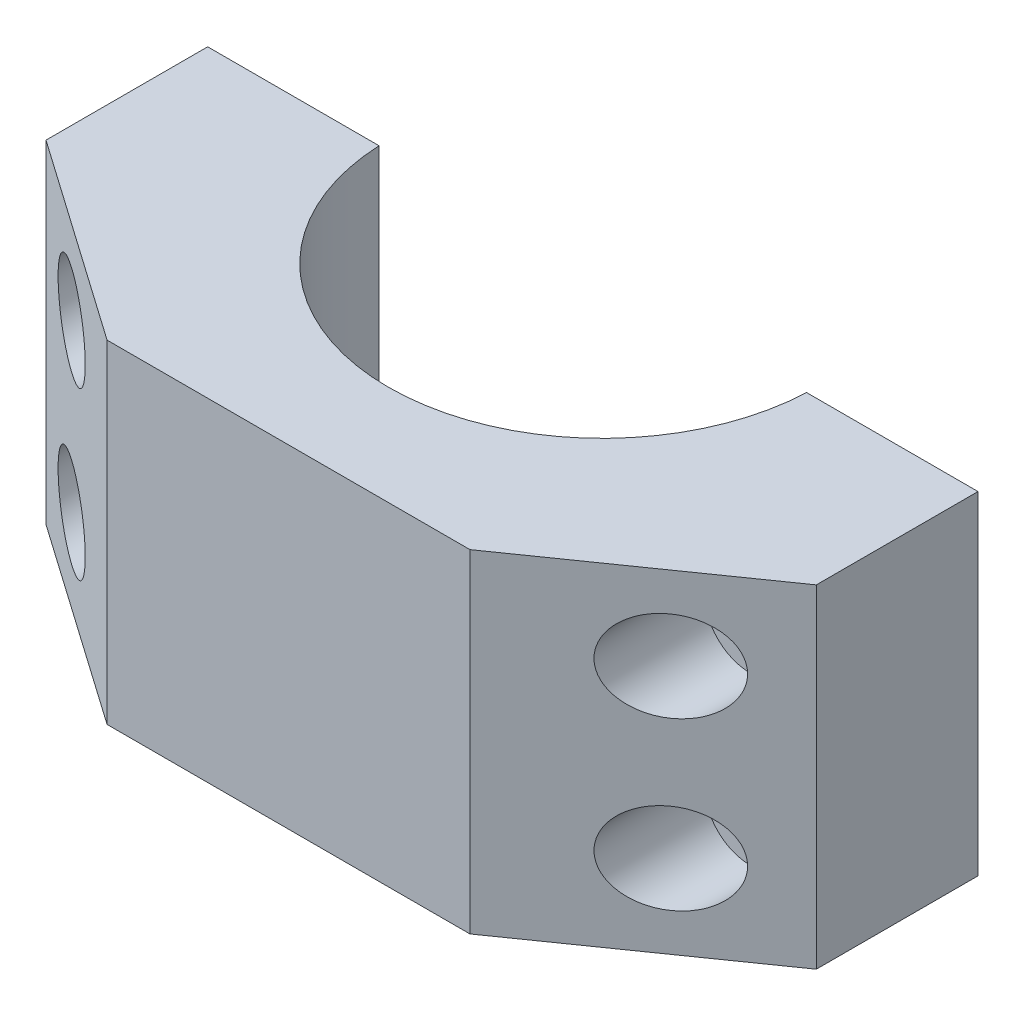
from build123d import *

# Parameters (mm, degrees)
SALIENTE_EXTRUIR1_DEPTH = 35
CORTAR_EXTRUIR1_REACH   = 64.883
CROQUIS2_R              = 2.55
CROQUIS3_R              = 4.75
CORTAR_EXTRUIR2_DEPTH   = 17
CHAFL_N1_SIZE           = 15
CHAFL_N1_SIZE_2         = 21.422220101
CORTAR_EXTRUIR3_START   = -35
CROQUIS4_W              = 81
CROQUIS4_H              = 1
CORTAR_EXTRUIR3_DEPTH   = 35


with BuildPart() as part:
    # Croquis1 → Saliente-Extruir1 (new body)
    with BuildSketch(Plane(origin=(0, 0, 0), x_dir=(1, 0, 0), z_dir=(0, 1, 0))):
        with BuildLine():
            Line((22.5, 0), (40.5, 0))
            Line((40.5, 0), (40.5, -33))
            Line((40.5, -33), (-40.5, -33))
            Line((-40.5, -33), (-40.5, 0))
            Line((-40.5, 0), (-22.5, 0))
            ThreePointArc((-22.5, 0), (0, -22.5), (22.5, 0))
        make_face()
    extrude(amount=SALIENTE_EXTRUIR1_DEPTH)

    # Croquis2 → Cortar-Extruir1 (cut, up to next)
    with BuildSketch(Plane(origin=(0, 0, 0), x_dir=(-1, 0, 0), z_dir=(0, 0, -1)), mode=Mode.PRIVATE) as cortar_extruir1_sk1:
        with Locations((-31.5, 26.25)):
            Circle(CROQUIS2_R)
    cortar_extruir1_tool1 = extrude(cortar_extruir1_sk1.sketch, amount=-CORTAR_EXTRUIR1_REACH, mode=Mode.PRIVATE) & part.part
    # Croquis2 → Cortar-Extruir1 (cut, up to next)
    with BuildSketch(Plane(origin=(0, 0, 0), x_dir=(-1, 0, 0), z_dir=(0, 0, -1)), mode=Mode.PRIVATE) as cortar_extruir1_sk2:
        with Locations((-31.5, 8.75)):
            Circle(CROQUIS2_R)
    cortar_extruir1_tool2 = extrude(cortar_extruir1_sk2.sketch, amount=-CORTAR_EXTRUIR1_REACH, mode=Mode.PRIVATE) & part.part
    # Croquis2 → Cortar-Extruir1 (cut, up to next)
    with BuildSketch(Plane(origin=(0, 0, 0), x_dir=(-1, 0, 0), z_dir=(0, 0, -1)), mode=Mode.PRIVATE) as cortar_extruir1_sk3:
        with Locations((31.5, 8.75)):
            Circle(CROQUIS2_R)
    cortar_extruir1_tool3 = extrude(cortar_extruir1_sk3.sketch, amount=-CORTAR_EXTRUIR1_REACH, mode=Mode.PRIVATE) & part.part
    # Croquis2 → Cortar-Extruir1 (cut, up to next)
    with BuildSketch(Plane(origin=(0, 0, 0), x_dir=(-1, 0, 0), z_dir=(0, 0, -1)), mode=Mode.PRIVATE) as cortar_extruir1_sk4:
        with Locations((31.5, 26.25)):
            Circle(CROQUIS2_R)
    cortar_extruir1_tool4 = extrude(cortar_extruir1_sk4.sketch, amount=-CORTAR_EXTRUIR1_REACH, mode=Mode.PRIVATE) & part.part
    add(cortar_extruir1_tool1.solids().sort_by_distance((31.5, 26.25, 0))[0], mode=Mode.SUBTRACT)
    add(cortar_extruir1_tool2.solids().sort_by_distance((31.5, 8.75, 0))[0], mode=Mode.SUBTRACT)
    add(cortar_extruir1_tool3.solids().sort_by_distance((-31.5, 8.75, 0))[0], mode=Mode.SUBTRACT)
    add(cortar_extruir1_tool4.solids().sort_by_distance((-31.5, 26.25, 0))[0], mode=Mode.SUBTRACT)

    # Croquis3 → Cortar-Extruir2 (cut)
    with BuildSketch(Plane.XY.offset(33)):
        with Locations((-31.5, 26.25)):
            Circle(CROQUIS3_R)
        with Locations((-31.5, 8.75)):
            Circle(CROQUIS3_R)
        with Locations((31.5, 26.25)):
            Circle(CROQUIS3_R)
        with Locations((31.5, 8.75)):
            Circle(CROQUIS3_R)
    extrude(amount=-CORTAR_EXTRUIR2_DEPTH, mode=Mode.SUBTRACT)

    # Chaflán1
    # the kernel refuses this chamfer: 21.422220101, 15 mm, written as the material it takes off along each edge
    with BuildSketch(Plane(origin=(40.5, -55.3240023, 33), x_dir=(0.045263737714021264, 0, -0.9989750717851553), z_dir=(0, 1, 0))) as chafl_n1_piece_1:
        Polygon((CHAFL_N1_SIZE * 0.998975071785, CHAFL_N1_SIZE * 0.045263737714), (-CHAFL_N1_SIZE_2 * 0.0452637377143, CHAFL_N1_SIZE_2 * 0.998975071791), (0, 0), align=None)
    extrude(amount=145.6480046, mode=Mode.SUBTRACT)
    with BuildSketch(Plane(origin=(-40.5, -55.3240023, 33), x_dir=(0.9997533347641299, 0, 0.022209674198456895), z_dir=(0, 1, 0))) as chafl_n1_piece_2:
        Polygon((CHAFL_N1_SIZE_2 * 0.99975333477, CHAFL_N1_SIZE_2 * 0.0222096741986), (-CHAFL_N1_SIZE * 0.0222096741985, CHAFL_N1_SIZE * 0.999753334764), (0, 0), align=None)
    extrude(amount=145.6480046, mode=Mode.SUBTRACT)

    # Croquis4 → Cortar-Extruir3 (cut)
    with BuildSketch(Plane(origin=(0, 35, 0), x_dir=(1, 0, 0), z_dir=(0, 1, 0)).offset(CORTAR_EXTRUIR3_START)):
        with Locations((0, -0.5)):
            Rectangle(CROQUIS4_W, CROQUIS4_H)
    extrude(amount=CORTAR_EXTRUIR3_DEPTH, mode=Mode.SUBTRACT)


solid = part.part
